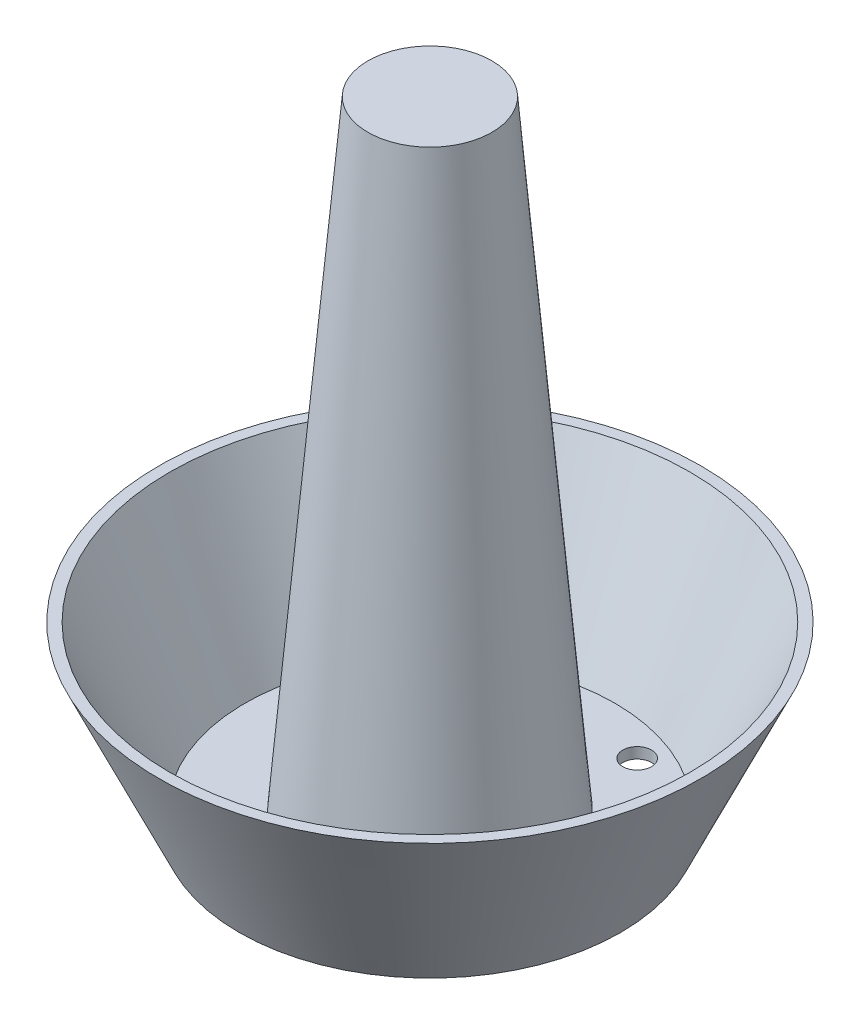
from build123d import *

# Parameters (mm, degrees)
F_5_16_CLEARANCE_HOLE1_D = 8.4328
SKETCH2_R                = 5.461
RF_CONNECTOR_DEPTH       = 12.7


with BuildPart() as part:
    # Sketch1 → Revolve1 (revolve)
    with BuildSketch(Plane.XY):
        Polygon((0, 184.15), (18.161, 184.15), (33.655, 3.175), (54.1734375, 3.175), (76.2, 50.8), (79.375, 50.8), (55.88, 0), (0, 0), align=None)
    revolve(axis=Axis((0, 0, 0), (0, 1, 0)))

    # 5/16 Clearance Hole1 (through all)
    with Locations(Plane(origin=(0, 0, 0), x_dir=(-1, 0, 0), z_dir=(0, -1, 0))):
        with Locations((17.272, -43.434), (-17.272, -43.434)):
            f_5_16_clearance_hole1 = Hole(F_5_16_CLEARANCE_HOLE1_D / 2)

    # Sketch2 → RF Connector (add)
    with BuildSketch(Plane.XZ):
        with Locations((-14.986, 0)):
            Circle(SKETCH2_R)
    extrude(amount=RF_CONNECTOR_DEPTH)

    # Mirror1: 5/16 Clearance Hole1 across plane
    add(f_5_16_clearance_hole1.mirror(Plane.XY), mode=Mode.SUBTRACT)


solid = part.part
